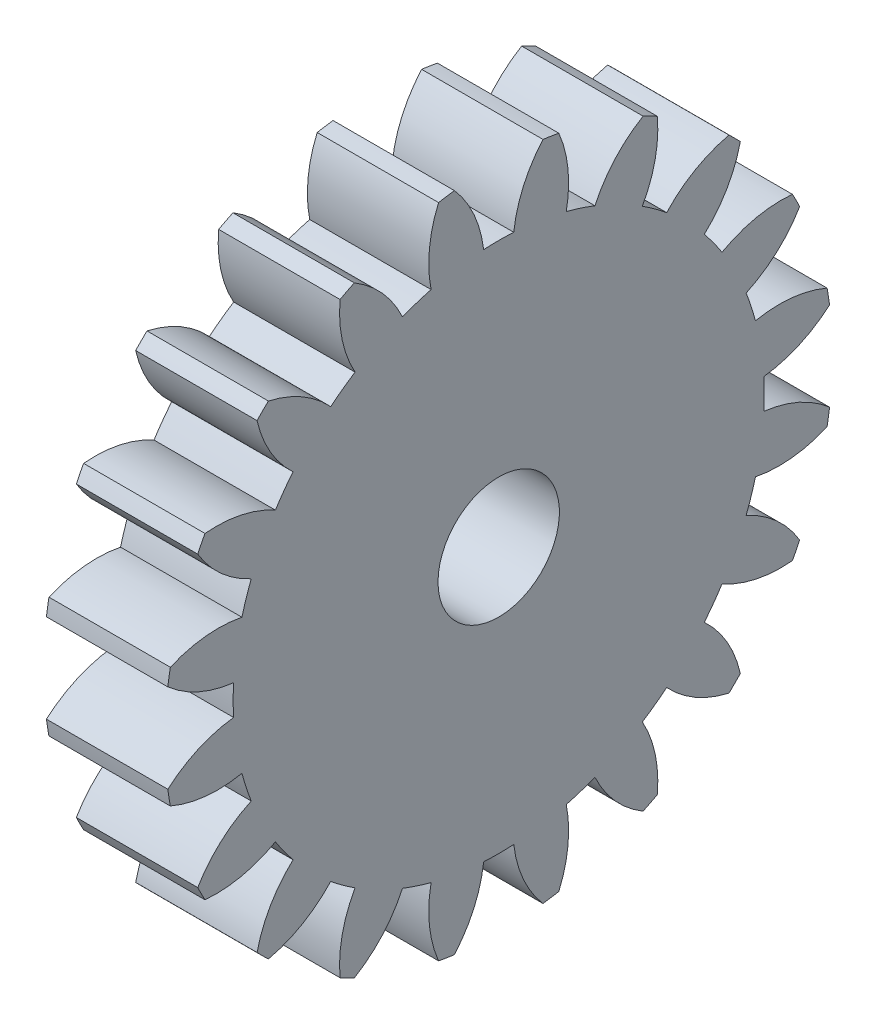
from build123d import *

# Parameters (mm, degrees)
BASPROSKE_W     = 6
BASPROSKE_H     = 16.5
TOOTHCUT_DEPTH  = 25.093567606
TEETHCUTS_COUNT = 20
TEETHCUTS_ANGLE = 342
BORSKE_R        = 3
BORE_DEPTH      = 50.0000508


with BuildPart() as part:
    # BasProSke → Base-Revolve (revolve)
    with BuildSketch(Plane(origin=(0, 0, 0), x_dir=(1, 0, 0), z_dir=(0, 1, 0))):
        with Locations((3, 8.25)):
            Rectangle(BASPROSKE_W, BASPROSKE_H)
    revolve(axis=Axis((-10, 0, 0), (1, 0, 0)))

    # TooCutSke → ToothCut (cut, through all)
    with BuildSketch(Plane(origin=(0, 0, 0), x_dir=(0, 0, -1), z_dir=(1, 0, 0))):
        with BuildLine():
            ThreePointArc((0.74381438, 13.102904875), (0, 13.124), (-0.74381438, 13.102904875))
            ThreePointArc((-0.74381438, 13.102904875), (-1.226473103, 14.852072512), (-2.209965745, 16.376962373))
            ThreePointArc((-2.209965745, 16.376962373), (0, 16.5254), (2.209965745, 16.376962373))
            ThreePointArc((2.209965745, 16.376962373), (1.226473103, 14.852072512), (0.74381438, 13.102904875))
        make_face()
    toothcut = extrude(amount=TOOTHCUT_DEPTH, mode=Mode.SUBTRACT)

    # TeethCuts: ToothCut ×20 about axis
    teethcuts_axis = Axis((-10, 0, 0), (1, 0, 0))
    for i in range(1, TEETHCUTS_COUNT):
        add(toothcut.rotate(teethcuts_axis, i * TEETHCUTS_ANGLE / (TEETHCUTS_COUNT - 1)), mode=Mode.SUBTRACT)

    # BorSke → Bore (cut, symmetric)
    with BuildSketch(Plane(origin=(0, 0, 0), x_dir=(0, 0, -1), z_dir=(1, 0, 0))):
        Circle(BORSKE_R)
    extrude(amount=BORE_DEPTH, both=True, mode=Mode.SUBTRACT)


solid = part.part
